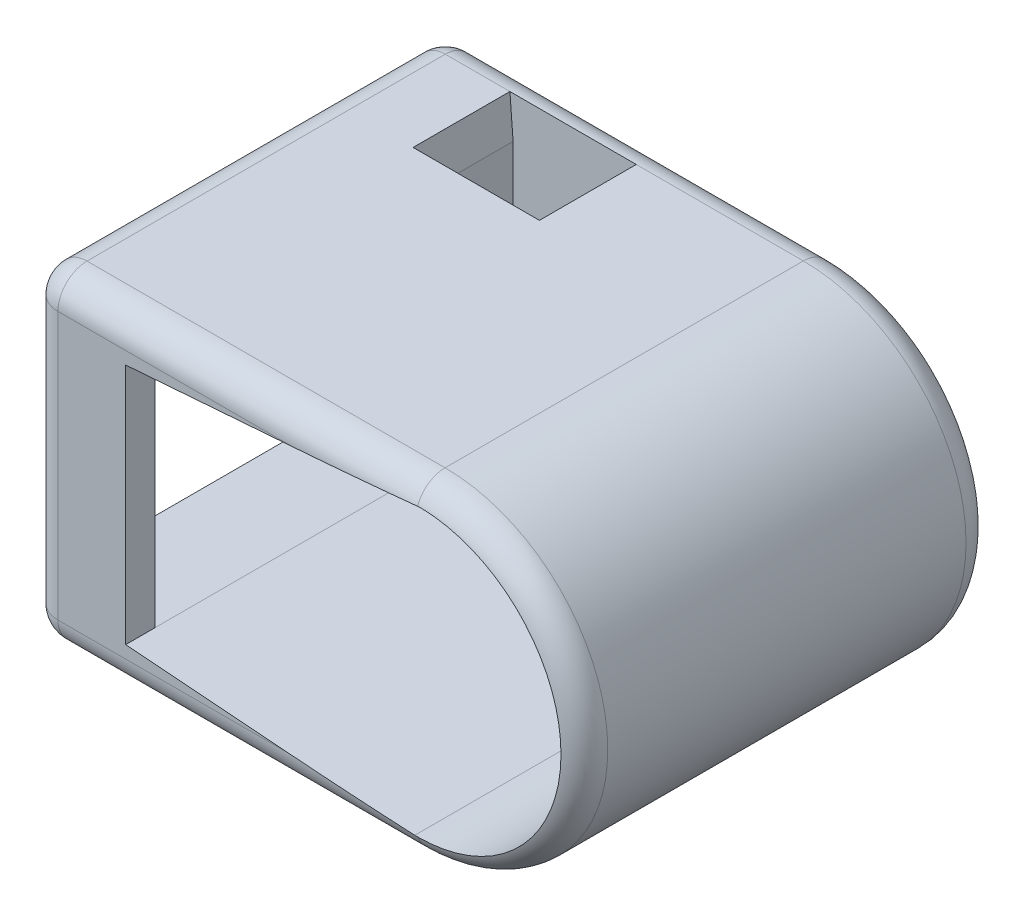
from build123d import *

# Parameters (mm, degrees)
EXTRUDE_9_DEPTH      = 40
EXTRUDE_START        = 3
EXTRUDE_10_DEPTH     = 3
SKETCH_11_R          = 10
CUT_EXTRUDE_1_DEPTH  = 3
EXTRUDE_11_DEPTH     = 10
SKETCH_21_W          = 13.008941923
SKETCH_21_H          = 10
CUT_EXTRUDE_9_DEPTH  = 65.045413014
EXTRUDE_12_REACH     = 65.691
SKETCH_23_W          = 10
SKETCH_23_H          = 3
FILLET_1_R           = 3
FILLET_2_R           = 3
FILLET_3_DEPTH       = 10
CUT_EXTRUDE_10_REACH = 63.068


with BuildPart() as part:
    # 草图5 → 凸台-拉伸9 (new body)
    with BuildSketch(Plane.XY):
        with BuildLine():
            Line((0, 16.799900253), (-39.976031579, 16.799900253))
            Line((-39.976031579, 16.799900253), (-39.976031579, 12.499900253))
            Line((-39.976031579, 12.499900253), (-29.976031579, 12.499900253))
            Line((-29.976031579, 12.499900253), (0.295610531, 14.79704749))
            ThreePointArc((0.295610531, 14.79704749), (14.79704749, -0.295610531), (-0.295610531, -14.79704749))
            Line((-0.295610531, -14.79704749), (-29.976031579, -12.499900253))
            Line((-29.976031579, -12.499900253), (-39.976031579, -12.499900253))
            Line((-39.976031579, -12.499900253), (-39.976031579, -16.799900253))
            Line((-39.976031579, -16.799900253), (0, -16.799900253))
            ThreePointArc((0, -16.799900253), (16.799900253, 0), (0, 16.799900253))
        make_face()
    extrude(amount=EXTRUDE_9_DEPTH)

    # 草图10 → 凸台-拉伸10 (add)
    with BuildSketch(Plane(origin=(0, 0, 0), x_dir=(-1, 0, 0), z_dir=(0, 0, -1)).offset(EXTRUDE_START)):
        with BuildLine():
            Line((0, -16.799900253), (39.976031579, -16.799900253))
            Line((39.976031579, -16.799900253), (39.976031579, 16.799900253))
            Line((39.976031579, 16.799900253), (0, 16.799900253))
            ThreePointArc((0, 16.799900253), (-16.799900253, 0), (0, -16.799900253))
        make_face()
    extrude(amount=-EXTRUDE_10_DEPTH)

    # 草图11 → 切除-拉伸1 (cut)
    with BuildSketch(Plane(origin=(0, 0, -3), x_dir=(-1, 0, 0), z_dir=(0, 0, -1))):
        Circle(SKETCH_11_R)
    extrude(amount=-CUT_EXTRUDE_1_DEPTH, mode=Mode.SUBTRACT)

    # 草图18 → 凸台-拉伸11 (add)
    with BuildSketch(Plane.XY):
        with BuildLine():
            Line((-39.976031579, -12.499900253), (-29.976031579, -12.499900253))
            Line((-29.976031579, -12.499900253), (-20.032968003, -13.26945406))
            Line((-20.032968003, -13.26945406), (-0.295610531, -14.79704749))
            ThreePointArc((-0.295610531, -14.79704749), (14.79704749, -0.295610531), (0.295610531, 14.79704749))
            Line((0.295610531, 14.79704749), (-17.004384343, 13.484246708))
            Line((-17.004384343, 13.484246708), (-17.004384343, 5))
            Line((-17.004384343, 5), (-8.660254038, 5))
            ThreePointArc((-8.660254038, 5), (10, 0), (-8.660254038, -5))
            Line((-8.660254038, -5), (-20, -5))
            Line((-20, -5), (-29.976031579, -5))
            Line((-29.976031579, -5), (-29.976031579, 5))
            Line((-29.976031579, 5), (-29.976031579, 12.499900253))
            Line((-29.976031579, 12.499900253), (-39.976031579, 12.499900253))
            Line((-39.976031579, 12.499900253), (-39.976031579, -12.499900253))
        make_face()
    extrude(amount=EXTRUDE_11_DEPTH)

    # 草图21 → 切除-拉伸9 (cut, through all)
    with BuildSketch(Plane(origin=(-1.114744508, 14.690023458, 0), x_dir=(0.9971331498487674, 0.07566691134621262, 0), z_dir=(0.07566691134621262, -0.9971331498487674, 0))):
        with Locations((-22.439794983, 5)):
            Rectangle(SKETCH_21_W, SKETCH_21_H)
    extrude(amount=-CUT_EXTRUDE_9_DEPTH, mode=Mode.SUBTRACT)

    # 草图23 → 凸台-拉伸12 (add, up to next)
    with BuildSketch(Plane.XZ.offset(-12.499900253), mode=Mode.PRIVATE) as extrude_12_sk1:
        with Locations((-34.976031579, 38.5)):
            Rectangle(SKETCH_23_W, SKETCH_23_H)
    extrude_12_tool1 = extrude(extrude_12_sk1.sketch, amount=EXTRUDE_12_REACH, mode=Mode.PRIVATE) - part.part
    add(extrude_12_tool1.solids().sort_by_distance((-34.976032, 12.4999, 38.5))[0])

    # 圆角1
    # the kernel refuses this fillet: 3 mm, written as the material it takes off along each edge
    with BuildSketch(Plane(origin=(-47.476031579, -16.799900253, 40), x_dir=(0, 0, -1), z_dir=(1, 0, 0)), Plane(origin=(0, 16.799900253, 40), x_dir=(0, 0, -1), z_dir=(-1, 0, 0))) as fillet_1_piece_1:
        with BuildLine():
            CenterArc((FILLET_1_R, FILLET_1_R), FILLET_1_R, 180, 90)
            Line((0, FILLET_1_R), (0, 0))
            Line((0, 0), (FILLET_1_R, 0))
        make_face()
    extrude(amount=47.476031579, mode=Mode.SUBTRACT)
    with BuildSketch(Plane(origin=(0, 0, 40), x_dir=(0, -1, 0), z_dir=(-1, 0, 0))) as fillet_1_piece_2:
        with BuildLine():
            CenterArc((16.799900253 - FILLET_1_R, -FILLET_1_R), FILLET_1_R, 0, 90)
            Line((16.799900253, -FILLET_1_R), (16.799900253, 0))
            Line((16.799900253, 0), (16.799900253 - FILLET_1_R, 0))
        make_face()
    revolve(axis=Axis((0, 0, 40), (0, 0, 1)), revolution_arc=180, mode=Mode.SUBTRACT)

    # 圆角2
    fillet_2_edges = [part.edges().sort_by_distance(p)[0] for p in [
        (-39.976031579, 0, 40),
        (-39.976031579, -16.799900253, 17),
        (-39.976031579, 16.799900253, 17),
        (-39.976031579, 15.921220597, 39.121320344),
        (-39.976031579, -15.921220597, 39.121320344),
        (16.799900253, 0, -3),
        (-19.988015789, -16.799900253, -3),
        (-39.976031579, 0, -3),
        (-19.988015789, 16.799900253, -3),
    ]]
    fillet(fillet_2_edges, radius=FILLET_2_R - 0.0001)  # a hair under: the kernel refuses the full size

    # 圆角3: read off the stored shape, not the designer's step
    # 圆角3 outline → 圆角3 (cut)
    with BuildSketch(Plane.XY):
        with BuildLine():
            Line((-17.004384343, 5), (-8.660254038, 5))
            ThreePointArc((-8.660254038, 5), (-14.43892528, 8.102315607), (-17.052465962, 14.117862844))
            Line((-17.052465962, 14.117862844), (-17.004384343, 13.484246708))
            Line((-17.004384343, 13.484246708), (-17.004384343, 5))
        make_face()
    extrude(amount=FILLET_3_DEPTH, mode=Mode.SUBTRACT)

    # 草图27 → 切除-拉伸10 (cut, up to next)
    with BuildSketch(Plane(origin=(0, 0, -3), x_dir=(-1, 0, 0), z_dir=(0, 0, -1)), mode=Mode.PRIVATE) as cut_extrude_10_sk1:
        with BuildLine():
            ThreePointArc((9.928, -1.197838052), (10, 0), (9.928, 1.197838052))
            ThreePointArc((9.928, 1.197838052), (11.2, 0), (9.928, -1.197838052))
        make_face()
    cut_extrude_10_tool1 = extrude(cut_extrude_10_sk1.sketch, amount=-CUT_EXTRUDE_10_REACH, mode=Mode.PRIVATE) & part.part
    # 草图27 → 切除-拉伸10 (cut, up to next)
    with BuildSketch(Plane(origin=(0, 0, -3), x_dir=(-1, 0, 0), z_dir=(0, 0, -1)), mode=Mode.PRIVATE) as cut_extrude_10_sk2:
        with BuildLine():
            ThreePointArc((-6.173156714, -7.867155533), (-7.919595949, -7.919595949), (-7.867155533, -6.173156714))
            ThreePointArc((-7.867155533, -6.173156714), (-7.071067812, -7.071067812), (-6.173156714, -7.867155533))
        make_face()
    cut_extrude_10_tool2 = extrude(cut_extrude_10_sk2.sketch, amount=-CUT_EXTRUDE_10_REACH, mode=Mode.PRIVATE) & part.part
    # 草图27 → 切除-拉伸10 (cut, up to next)
    with BuildSketch(Plane(origin=(0, 0, -3), x_dir=(-1, 0, 0), z_dir=(0, 0, -1)), mode=Mode.PRIVATE) as cut_extrude_10_sk3:
        with BuildLine():
            ThreePointArc((-7.867155533, 6.173156714), (-7.071067812, 7.071067812), (-6.173156714, 7.867155533))
            ThreePointArc((-6.173156714, 7.867155533), (-7.919595949, 7.919595949), (-7.867155533, 6.173156714))
        make_face()
    cut_extrude_10_tool3 = extrude(cut_extrude_10_sk3.sketch, amount=-CUT_EXTRUDE_10_REACH, mode=Mode.PRIVATE) & part.part
    add(cut_extrude_10_tool1.solids().sort_by_distance((-10.496108, 0, -3))[0], mode=Mode.SUBTRACT)
    add(cut_extrude_10_tool2.solids().sort_by_distance((7.421869, -7.421869, -3))[0], mode=Mode.SUBTRACT)
    add(cut_extrude_10_tool3.solids().sort_by_distance((7.421869, 7.421869, -3))[0], mode=Mode.SUBTRACT)


solid = part.part
